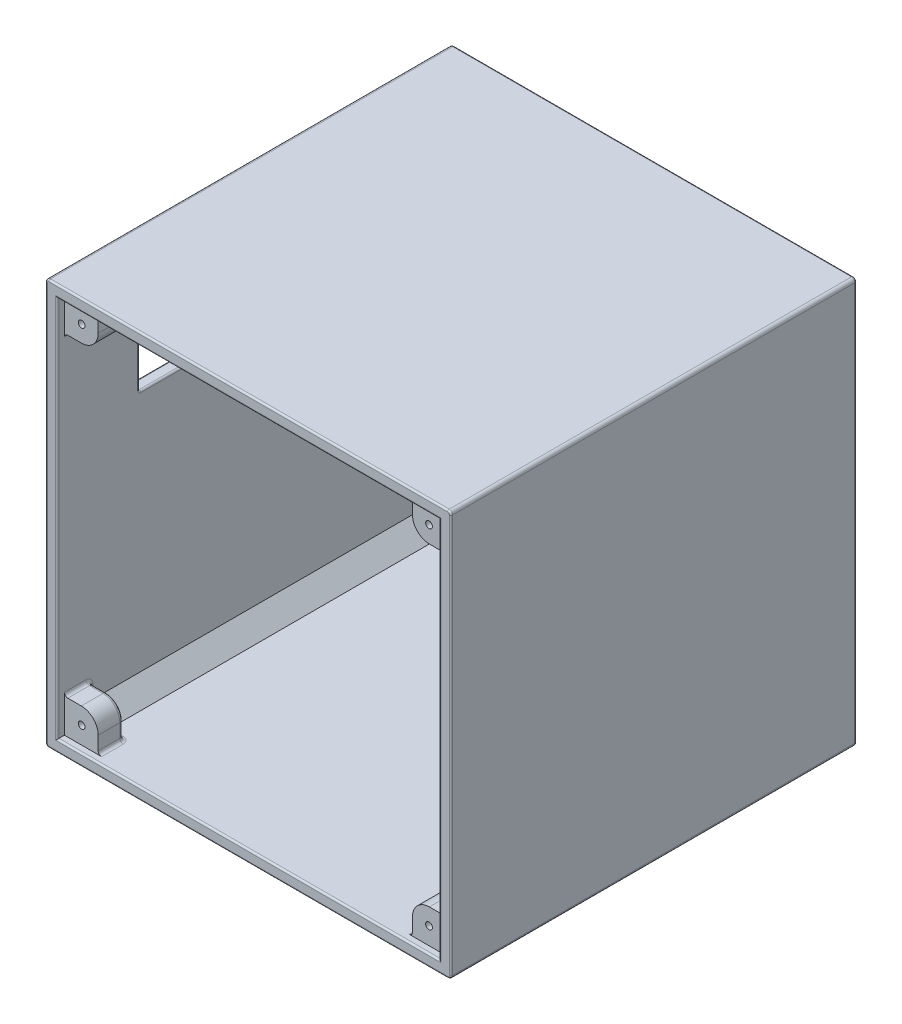
from build123d import *

# Parameters (mm, degrees)
ESBO_O2_W                     = 120
ESBO_O2_H                     = 120
RESSALTO_EXTRUS_O1_DEPTH      = 120
ESBO_O3_W                     = 113
ESBO_O3_H                     = 113
CORTE_EXTRUS_O1_DEPTH         = 120
RESSALTO_EXTRUS_O2_DEPTH      = 7
RESSALTO_EXTRUS_O6_DEPTH      = 7
CHANFRO1_SIZE                 = 5
CHANFRO2_SIZE                 = 5
ESBO_O14_W                    = 71.5
ESBO_O14_H                    = 24.5
CORTE_EXTRUS_O6_DEPTH         = 10
ESBO_O15_W                    = 113
ESBO_O15_H                    = 113
CORTE_EXTRUS_O7_DEPTH         = 5
FILETE3_R                     = 1
FILETE4_R                     = 1
RESSALTO_EXTRUS_O7_DEPTH      = 1.4
RESSALTO_EXTRUS_O7_DEPTH_BACK = 6
FILETE8_R                     = 1
CORTE_EXTRUS_O8_REACH         = 147.26
ESBO_O16_R                    = 1
ESPELHAR2_COPY_1_REACH        = 147.26
ESPELHAR2_COPY_1_SKETCH_R     = 1
ESPELHAR2_COPY_2_REACH        = 147.26
ESPELHAR2_COPY_2_SKETCH_R     = 1
CORTE_EXTRUS_O9_REACH         = 143.312
ESBO_O17_R                    = 1.75
ESBO_O18_R                    = 3.6
CORTE_EXTRUS_O10_DEPTH        = 1
ESPELHAR6_COPY_1_REACH        = 143.312
ESPELHAR6_COPY_1_SKETCH_R     = 1.75
ESPELHAR6_COPY_2_SKETCH_R     = 3.6
ESPELHAR6_COPY_2_DEPTH        = 1
ESPELHAR6_COPY_3_REACH        = 143.312
ESPELHAR6_COPY_3_SKETCH_R     = 1.75
ESPELHAR6_COPY_4_SKETCH_R     = 3.6
ESPELHAR6_COPY_4_DEPTH        = 1
ESBO_O19_R                    = 3.6
CORTE_EXTRUS_O12_DEPTH        = 0.5
ESBO_O21_R                    = 1.75
CORTE_EXTRUS_O13_DEPTH        = 142.711855538
FILETE9_R                     = 0.5


with BuildPart() as part:
    # Esboço2 → Ressalto-extrusão1 (new body)
    with BuildSketch(Plane.XY):
        Rectangle(ESBO_O2_W, ESBO_O2_H)
    extrude(amount=RESSALTO_EXTRUS_O1_DEPTH)

    # Esboço3 → Corte-extrusão1 (cut)
    with BuildSketch(Plane.XY.offset(120)):
        Rectangle(ESBO_O3_W, ESBO_O3_H)
    extrude(amount=-CORTE_EXTRUS_O1_DEPTH, mode=Mode.SUBTRACT)

    # Esboço4 → Ressalto-extrusão2 (add)
    with BuildSketch(Plane.XY):
        with BuildLine():
            Line((-51.5, 46.5), (-56.5, 46.5))
            Line((-56.5, 46.5), (-56.5, 56.5))
            Line((-56.5, 56.5), (-46.5, 56.5))
            Line((-46.5, 56.5), (-46.5, 51.5))
            ThreePointArc((-46.5, 51.5), (-47.964466094, 47.964466094), (-51.5, 46.5))
        make_face()
        with BuildLine():
            Line((46.5, 56.5), (46.5, 51.5))
            ThreePointArc((46.5, 51.5), (47.964466094, 47.964466094), (51.5, 46.5))
            Line((51.5, 46.5), (56.5, 46.5))
            Line((56.5, 46.5), (56.5, 56.5))
            Line((56.5, 56.5), (46.5, 56.5))
        make_face()
        with BuildLine():
            Line((51.5, -46.5), (56.5, -46.5))
            Line((56.5, -46.5), (56.5, -56.5))
            Line((56.5, -56.5), (46.5, -56.5))
            Line((46.5, -56.5), (46.5, -51.5))
            ThreePointArc((46.5, -51.5), (47.964466094, -47.964466094), (51.5, -46.5))
        make_face()
        with BuildLine():
            Line((-46.5, -56.5), (-46.5, -51.5))
            ThreePointArc((-46.5, -51.5), (-47.964466094, -47.964466094), (-51.5, -46.5))
            Line((-51.5, -46.5), (-56.5, -46.5))
            Line((-56.5, -46.5), (-56.5, -56.5))
            Line((-56.5, -56.5), (-46.5, -56.5))
        make_face()
        with BuildLine():
            Line((-51.5, 5), (-56.5, 5))
            Line((-56.5, 5), (-56.5, -5))
            Line((-56.5, -5), (-51.5, -5))
            ThreePointArc((-51.5, -5), (-46.5, 0), (-51.5, 5))
        make_face()
        with BuildLine():
            Line((56.5, -5), (51.5, -5))
            ThreePointArc((51.5, -5), (46.5, 0), (51.5, 5))
            Line((51.5, 5), (56.5, 5))
            Line((56.5, 5), (56.5, -5))
        make_face()
        with BuildLine():
            Line((-5, 51.5), (-5, 56.5))
            Line((-5, 56.5), (5, 56.5))
            Line((5, 56.5), (5, 51.5))
            ThreePointArc((5, 51.5), (0, 46.5), (-5, 51.5))
        make_face()
    extrude(amount=RESSALTO_EXTRUS_O2_DEPTH)

    # Esboço13 → Ressalto-extrusão6 (add)
    with BuildSketch(Plane.XY):
        with BuildLine():
            Line((-5, -51.5), (-5, -56.5))
            Line((-5, -56.5), (5, -56.5))
            Line((5, -56.5), (5, -51.5))
            ThreePointArc((5, -51.5), (0, -46.5), (-5, -51.5))
        make_face()
    extrude(amount=RESSALTO_EXTRUS_O6_DEPTH)

    # Chanfro1
    chanfro1_edges = [part.edges().sort_by_distance(p)[0] for p in [
        (-56.5, 56.5, 63.5),
    ]]
    chamfer(chanfro1_edges, length=CHANFRO1_SIZE)

    # Chanfro2
    chanfro2_edges = [part.edges().sort_by_distance(p)[0] for p in [
        (-56.5, -56.5, 63.5),
        (56.5, -56.5, 63.5),
        (56.5, 56.5, 63.5),
    ]]
    chamfer(chanfro2_edges, length=CHANFRO2_SIZE)

    # Esboço14 → Corte-extrusão6 (cut)
    with BuildSketch(Plane.ZY.offset(60)):
        with Locations((60, 32.75)):
            Rectangle(ESBO_O14_W, ESBO_O14_H)
    extrude(amount=-CORTE_EXTRUS_O6_DEPTH, mode=Mode.SUBTRACT)

    # Esboço15 → Corte-extrusão7 (cut)
    with BuildSketch(Plane.XY.offset(120)):
        Rectangle(ESBO_O15_W, ESBO_O15_H)
    extrude(amount=-CORTE_EXTRUS_O7_DEPTH, mode=Mode.SUBTRACT)

    # Filete3
    filete3_edges = [part.edges().sort_by_distance(p)[0] for p in [
        (-60, 60, 60),
    ]]
    fillet(filete3_edges, radius=FILETE3_R)

    # Filete4
    filete4_edges = [part.edges().sort_by_distance(p)[0] for p in [
        (60, 60, 60),
        (60, -60, 60),
        (-60, -60, 60),
    ]]
    fillet(filete4_edges, radius=FILETE4_R)

    # Esboço5 → Ressalto-extrusão7 (add, two sides: drawn at the far end of the back side and taken through both)
    with BuildSketch(Plane.XY.offset(116.5).offset(-RESSALTO_EXTRUS_O7_DEPTH_BACK)):
        with BuildLine():
            Line((-51.5, 46.5), (-56.5, 46.5))
            Line((-56.5, 46.5), (-56.5, 56.5))
            Line((-56.5, 56.5), (-46.5, 56.5))
            Line((-46.5, 56.5), (-46.5, 51.5))
            ThreePointArc((-46.5, 51.5), (-47.964466094, 47.964466094), (-51.5, 46.5))
        make_face()
        with BuildLine():
            Line((46.5, 56.5), (46.5, 51.5))
            ThreePointArc((46.5, 51.5), (47.964466094, 47.964466094), (51.5, 46.5))
            Line((51.5, 46.5), (56.5, 46.5))
            Line((56.5, 46.5), (56.5, 56.5))
            Line((56.5, 56.5), (46.5, 56.5))
        make_face()
        with BuildLine():
            Line((51.5, -46.5), (56.5, -46.5))
            Line((56.5, -46.5), (56.5, -56.5))
            Line((56.5, -56.5), (46.5, -56.5))
            Line((46.5, -56.5), (46.5, -51.5))
            ThreePointArc((46.5, -51.5), (47.964466094, -47.964466094), (51.5, -46.5))
        make_face()
        with BuildLine():
            Line((-46.5, -56.5), (-46.5, -51.5))
            ThreePointArc((-46.5, -51.5), (-47.964466094, -47.964466094), (-51.5, -46.5))
            Line((-51.5, -46.5), (-56.5, -46.5))
            Line((-56.5, -46.5), (-56.5, -56.5))
            Line((-56.5, -56.5), (-46.5, -56.5))
        make_face()
    extrude(amount=RESSALTO_EXTRUS_O7_DEPTH + RESSALTO_EXTRUS_O7_DEPTH_BACK)

    # Filete8
    filete8_edges = [part.edges().sort_by_distance(p)[0] for p in [
        (56.5, 46.5, 3.5),
        (46.5, 56.5, 3.5),
        (54, 46.5, 7),
        (47.964466094, 47.964466094, 7),
        (46.5, 54, 7),
        (49, 56.5, 7),
        (54, 54, 7),
        (56.5, 49, 7),
        (56.5, -46.5, 114.2),
        (46.5, -56.5, 114.2),
        (-46.5, -56.5, 114.2),
        (-56.5, -46.5, 114.2),
        (-56.5, 46.5, 114.2),
        (-46.5, 56.5, 114.2),
        (46.5, 56.5, 114.2),
        (56.5, 46.5, 114.2),
        (56.5, 5, 3.5),
        (56.5, -5, 3.5),
        (46.5, -56.5, 3.5),
        (56.5, -46.5, 3.5),
        (5, -56.5, 3.5),
        (-5, -56.5, 3.5),
        (-56.5, -46.5, 3.5),
        (-46.5, -56.5, 3.5),
        (-56.5, -5, 3.5),
        (-56.5, 5, 3.5),
        (-46.5, 56.5, 3.5),
        (-56.5, 46.5, 3.5),
        (-5, 56.5, 3.5),
        (5, 56.5, 3.5),
        (54, -46.5, 110.5),
        (47.964466094, -47.964466094, 110.5),
        (46.5, -54, 110.5),
        (49, -56.5, 110.5),
        (54, -54, 110.5),
        (56.5, -49, 110.5),
        (-49, -56.5, 110.5),
        (-46.5, -54, 110.5),
        (-47.964466094, -47.964466094, 110.5),
        (-54, -46.5, 110.5),
        (-56.5, -49, 110.5),
        (-54, -54, 110.5),
        (-54, 46.5, 110.5),
        (-47.964466094, 47.964466094, 110.5),
        (-46.5, 54, 110.5),
        (-49, 56.5, 110.5),
        (-54, 54, 110.5),
        (-56.5, 49, 110.5),
        (49, 56.5, 110.5),
        (46.5, 54, 110.5),
        (47.964466094, 47.964466094, 110.5),
        (54, 46.5, 110.5),
        (56.5, 49, 110.5),
        (54, 54, 110.5),
        (54, 5, 7),
        (56.5, 0, 7),
        (54, -5, 7),
        (46.5, 0, 7),
        (46.5, -54, 7),
        (47.964466094, -47.964466094, 7),
        (54, -46.5, 7),
        (56.5, -49, 7),
        (54, -54, 7),
        (49, -56.5, 7),
        (5, -54, 7),
        (0, -56.5, 7),
        (-5, -54, 7),
        (0, -46.5, 7),
        (-54, -46.5, 7),
        (-47.964466094, -47.964466094, 7),
        (-46.5, -54, 7),
        (-49, -56.5, 7),
        (-54, -54, 7),
        (-56.5, -49, 7),
        (-54, -5, 7),
        (-56.5, 0, 7),
        (-54, 5, 7),
        (-46.5, 0, 7),
        (-46.5, 54, 7),
        (-47.964466094, 47.964466094, 7),
        (-54, 46.5, 7),
        (-56.5, 49, 7),
        (-54, 54, 7),
        (-49, 56.5, 7),
        (0, 46.5, 7),
        (-5, 54, 7),
        (0, 56.5, 7),
        (5, 54, 7),
    ]]
    fillet(filete8_edges, radius=FILETE8_R)

    # Esboço16 → Corte-extrusão8 (cut, up to next)
    with BuildSketch(Plane.XY.offset(117.9), mode=Mode.PRIVATE) as corte_extrus_o8_sk1:
        with Locations((-51.4, 51.4)):
            Circle(ESBO_O16_R)
    corte_extrus_o8_tool1 = extrude(corte_extrus_o8_sk1.sketch, amount=-CORTE_EXTRUS_O8_REACH, mode=Mode.PRIVATE) & part.part
    corte_extrus_o8 = corte_extrus_o8_tool1.solids().sort_by_distance((-51.4, 51.4, 117.9))[0]
    add(corte_extrus_o8, mode=Mode.SUBTRACT)

    # Espelhar1: Corte-extrusão8 across plane
    add(corte_extrus_o8.mirror(Plane.ZX), mode=Mode.SUBTRACT)

    # Espelhar2 copy 1 sketch → Espelhar2 copy 1 (cut, up to next)
    with BuildSketch(Plane(origin=(0, 0, 117.9), x_dir=(-1, 0, 0), z_dir=(0, 0, 1)), mode=Mode.PRIVATE) as espelhar2_copy_1_sk1:
        with Locations((-51.4, 51.4)):
            Circle(ESPELHAR2_COPY_1_SKETCH_R)
    espelhar2_copy_1_tool1 = extrude(espelhar2_copy_1_sk1.sketch, amount=-ESPELHAR2_COPY_1_REACH, mode=Mode.PRIVATE) & part.part
    add(espelhar2_copy_1_tool1.solids().sort_by_distance((51.4, -51.4, 117.9))[0], mode=Mode.SUBTRACT)

    # Espelhar2 copy 2 sketch → Espelhar2 copy 2 (cut, up to next)
    with BuildSketch(Plane(origin=(0, 0, 117.9), x_dir=(-1, 0, 0), z_dir=(0, 0, 1)), mode=Mode.PRIVATE) as espelhar2_copy_2_sk1:
        with Locations((-51.4, -51.4)):
            Circle(ESPELHAR2_COPY_2_SKETCH_R)
    espelhar2_copy_2_tool1 = extrude(espelhar2_copy_2_sk1.sketch, amount=-ESPELHAR2_COPY_2_REACH, mode=Mode.PRIVATE) & part.part
    add(espelhar2_copy_2_tool1.solids().sort_by_distance((51.4, 51.4, 117.9))[0], mode=Mode.SUBTRACT)

    # Esboço17 → Corte-extrusão9 (cut, up to next)
    with BuildSketch(Plane.XY.offset(7), mode=Mode.PRIVATE) as corte_extrus_o9_sk1:
        with Locations((-51.4, 51.4)):
            Circle(ESBO_O17_R)
    corte_extrus_o9_tool1 = extrude(corte_extrus_o9_sk1.sketch, amount=-CORTE_EXTRUS_O9_REACH, mode=Mode.PRIVATE) & part.part
    corte_extrus_o9 = corte_extrus_o9_tool1.solids().sort_by_distance((-51.4, 51.4, 7))[0]
    add(corte_extrus_o9, mode=Mode.SUBTRACT)

    # Esboço18 → Corte-extrusão10 (cut, symmetric)
    with BuildSketch(Plane.XY.offset(7)):
        with Locations((-51.4, 51.4)):
            Circle(ESBO_O18_R)
    corte_extrus_o10 = extrude(amount=CORTE_EXTRUS_O10_DEPTH, both=True, mode=Mode.SUBTRACT)

    # Espelhar5: Corte-extrusão9, Corte-extrusão10 across plane
    add(corte_extrus_o9.mirror(Plane.ZX), mode=Mode.SUBTRACT)
    add(corte_extrus_o10.mirror(Plane.ZX), mode=Mode.SUBTRACT)

    # Espelhar6 copy 1 sketch → Espelhar6 copy 1 (cut, up to next)
    with BuildSketch(Plane(origin=(0, 0, 7), x_dir=(-1, 0, 0), z_dir=(0, 0, 1)), mode=Mode.PRIVATE) as espelhar6_copy_1_sk1:
        with Locations((-51.4, 51.4)):
            Circle(ESPELHAR6_COPY_1_SKETCH_R)
    espelhar6_copy_1_tool1 = extrude(espelhar6_copy_1_sk1.sketch, amount=-ESPELHAR6_COPY_1_REACH, mode=Mode.PRIVATE) & part.part
    add(espelhar6_copy_1_tool1.solids().sort_by_distance((51.4, -51.4, 7))[0], mode=Mode.SUBTRACT)

    # Espelhar6 copy 2 sketch → Espelhar6 copy 2 (cut, symmetric)
    with BuildSketch(Plane(origin=(0, 0, 7), x_dir=(-1, 0, 0), z_dir=(0, 0, 1))):
        with Locations((-51.4, 51.4)):
            Circle(ESPELHAR6_COPY_2_SKETCH_R)
    extrude(amount=ESPELHAR6_COPY_2_DEPTH, both=True, mode=Mode.SUBTRACT)

    # Espelhar6 copy 3 sketch → Espelhar6 copy 3 (cut, up to next)
    with BuildSketch(Plane(origin=(0, 0, 7), x_dir=(-1, 0, 0), z_dir=(0, 0, 1)), mode=Mode.PRIVATE) as espelhar6_copy_3_sk1:
        with Locations((-51.4, -51.4)):
            Circle(ESPELHAR6_COPY_3_SKETCH_R)
    espelhar6_copy_3_tool1 = extrude(espelhar6_copy_3_sk1.sketch, amount=-ESPELHAR6_COPY_3_REACH, mode=Mode.PRIVATE) & part.part
    add(espelhar6_copy_3_tool1.solids().sort_by_distance((51.4, 51.4, 7))[0], mode=Mode.SUBTRACT)

    # Espelhar6 copy 4 sketch → Espelhar6 copy 4 (cut, symmetric)
    with BuildSketch(Plane(origin=(0, 0, 7), x_dir=(-1, 0, 0), z_dir=(0, 0, 1))):
        with Locations((-51.4, -51.4)):
            Circle(ESPELHAR6_COPY_4_SKETCH_R)
    extrude(amount=ESPELHAR6_COPY_4_DEPTH, both=True, mode=Mode.SUBTRACT)

    # Esboço19 → Corte-extrusão12 (cut)
    with BuildSketch(Plane.XY.offset(7)):
        with Locations((-51.4, 0)):
            Circle(ESBO_O19_R)
        with Locations((0, 51.4)):
            Circle(ESBO_O19_R)
        with Locations((51.4, 0)):
            Circle(ESBO_O19_R)
        with Locations((0, -51.4)):
            Circle(ESBO_O19_R)
    extrude(amount=-CORTE_EXTRUS_O12_DEPTH, mode=Mode.SUBTRACT)

    # Esboço21 → Corte-extrusão13 (cut, through all)
    with BuildSketch(Plane.XY.offset(6.5)):
        with Locations((-51.4, 0)):
            Circle(ESBO_O21_R)
        with Locations((0, 51.4)):
            Circle(ESBO_O21_R)
        with Locations((51.4, 0)):
            Circle(ESBO_O21_R)
        with Locations((0, -51.4)):
            Circle(ESBO_O21_R)
    extrude(amount=-CORTE_EXTRUS_O13_DEPTH, mode=Mode.SUBTRACT)

    # Filete9
    filete9_edges = [part.edges().sort_by_distance(p)[0] for p in [
        (-59.707106781, 59.707106781, 0),
        (-60, 0, 0),
        (-59.707106781, -59.707106781, 0),
        (0, -60, 0),
        (59.707106781, -59.707106781, 0),
        (60, 0, 0),
        (59.707106781, 59.707106781, 0),
        (0, 60, 0),
        (47.964466094, -47.964466094, 0),
        (46.5, -53.5, 0),
        (46.207106781, -56.207106781, 0),
        (25.75, -56.5, 0),
        (5.292893219, -56.207106781, 0),
        (5, -53.5, 0),
        (0, -46.5, 0),
        (-5, -53.5, 0),
        (-5.292893219, -56.207106781, 0),
        (-25.75, -56.5, 0),
        (-46.207106781, -56.207106781, 0),
        (-46.5, -53.5, 0),
        (-47.964466094, -47.964466094, 0),
        (-53.5, -46.5, 0),
        (-56.207106781, -46.207106781, 0),
        (-56.5, -25.75, 0),
        (-56.207106781, -5.292893219, 0),
        (-53.5, -5, 0),
        (-46.5, 0, 0),
        (-53.5, 5, 0),
        (-56.207106781, 5.292893219, 0),
        (-56.5, 25.75, 0),
        (-56.207106781, 46.207106781, 0),
        (-53.5, 46.5, 0),
        (-47.964466094, 47.964466094, 0),
        (-46.5, 53.5, 0),
        (-46.207106781, 56.207106781, 0),
        (-25.75, 56.5, 0),
        (-5.292893219, 56.207106781, 0),
        (-5, 53.5, 0),
        (0, 46.5, 0),
        (5, 53.5, 0),
        (5.292893219, 56.207106781, 0),
        (25.75, 56.5, 0),
        (46.207106781, 56.207106781, 0),
        (46.5, 53.5, 0),
        (47.964466094, 47.964466094, 0),
        (53.5, 46.5, 0),
        (56.207106781, 46.207106781, 0),
        (56.5, 25.75, 0),
        (56.207106781, 5.292893219, 0),
        (53.5, 5, 0),
        (46.5, 0, 0),
        (53.5, -5, 0),
        (56.207106781, -5.292893219, 0),
        (56.5, -25.75, 0),
        (56.207106781, -46.207106781, 0),
        (53.5, -46.5, 0),
        (-53.15, 51.4, 0),
        (-53.15, -51.4, 0),
        (53.15, -51.4, 0),
        (53.15, 51.4, 0),
        (-1.75, -51.4, 0),
        (49.65, 0, 0),
        (-1.75, 51.4, 0),
        (-53.15, 0, 0),
        (-56.5, 20.5, 60),
        (-60, 20.5, 60),
        (-56.5, 32.75, 95.75),
        (-60, 32.75, 95.75),
        (-58.25, 20.5, 95.75),
        (-56.5, 45, 60),
        (-60, 45, 60),
        (-58.25, 45, 95.75),
        (-56.5, 32.75, 24.25),
        (-58.25, 20.5, 24.25),
        (-60, 32.75, 24.25),
        (-58.25, 45, 24.25),
        (59.707106781, -59.707106781, 120),
        (0, -60, 120),
        (-59.707106781, -59.707106781, 120),
        (-60, 0, 120),
        (-59.707106781, 59.707106781, 120),
        (0, 60, 120),
        (59.707106781, 59.707106781, 120),
        (60, 0, 120),
        (0, 56.5, 120),
        (-56.5, 0, 120),
        (0, -56.5, 120),
        (56.5, 0, 120),
    ]]
    fillet(filete9_edges, radius=FILETE9_R)


solid = part.part
